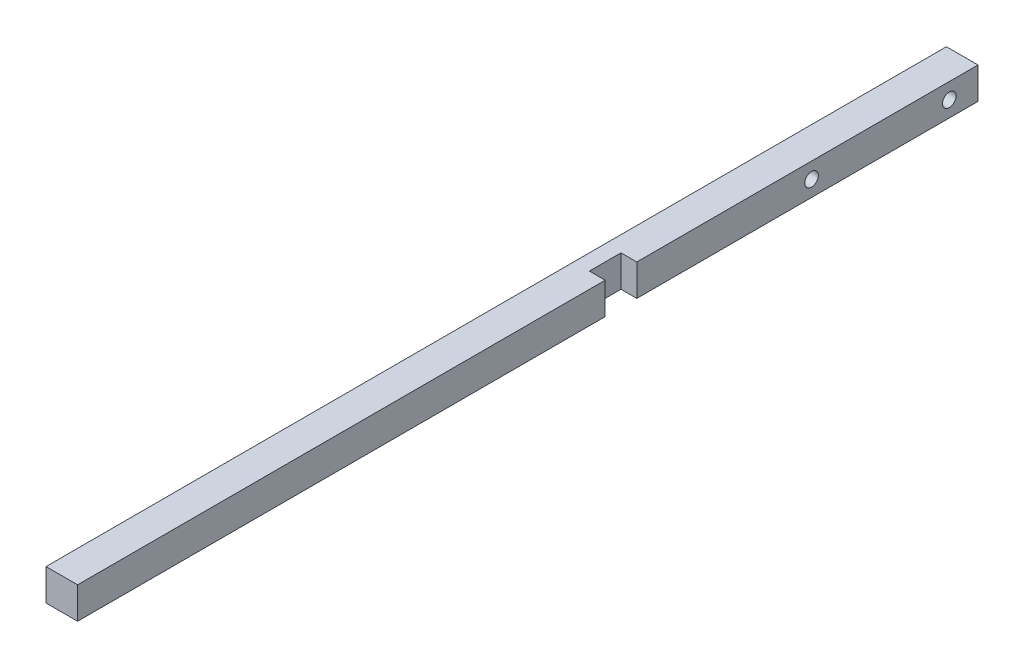
from build123d import *

# Parameters (mm, degrees)
ESQUISSE1_W                  = 10
ESQUISSE1_H                  = 10
BOSS_EXTRU_1_DEPTH           = 307
ENL_V_MAT_EXTRU_1_DEPTH      = 308.081422427
ENL_V_MAT_EXTRU_1_DEPTH_BACK = 308.081422427
ESQUISSE2_W                  = 10
ESQUISSE2_H                  = 22
D_GAGEMENT_M41_OUTLINE_W     = 10
D_GAGEMENT_M41_OUTLINE_H     = 10
D_GAGEMENT_M41_OUTLINE_R     = 2.15
D_GAGEMENT_M41_DEPTH         = 5
D_GAGEMENT_START             = -5
D_GAGEMENT_M41_2_OUTLINE_R   = 2.15
D_GAGEMENT_M41_2_DEPTH       = 5


# Read off the part's stored shape, not the designer's step: Dégagement M41
with BuildPart() as part:
    # Esquisse1 → Boss.-Extru.1 (new body)
    with BuildSketch(Plane.XY):
        Rectangle(ESQUISSE1_W, ESQUISSE1_H)
    extrude(amount=BOSS_EXTRU_1_DEPTH)

    # Esquisse2 → Enlèv. mat.-Extru.1 (cut, two sides: drawn at the far end of the back side and taken through both)
    with BuildSketch(Plane(origin=(0, 0, 0), x_dir=(1, 0, 0), z_dir=(0, 1, 0)).offset(-ENL_V_MAT_EXTRU_1_DEPTH_BACK)):
        with Locations((0, -11)):
            Rectangle(ESQUISSE2_W, ESQUISSE2_H)
    extrude(amount=ENL_V_MAT_EXTRU_1_DEPTH + ENL_V_MAT_EXTRU_1_DEPTH_BACK, mode=Mode.SUBTRACT)

    # Dégagement M41 outline → Dégagement M41 (cut)
    with BuildSketch(Plane.YZ):
        with Locations((0, 135)):
            Rectangle(D_GAGEMENT_M41_OUTLINE_W, D_GAGEMENT_M41_OUTLINE_H)
        with Locations((0, 31.09)):
            Circle(D_GAGEMENT_M41_OUTLINE_R)
        with Locations((0, 74.69)):
            Circle(D_GAGEMENT_M41_OUTLINE_R)
    extrude(amount=D_GAGEMENT_M41_DEPTH, mode=Mode.SUBTRACT)

    # D_gagement M41 2 outline → D_gagement M41 2 (cut)
    with BuildSketch(Plane.YZ.offset(D_GAGEMENT_START)):
        with Locations((0, 31.09)):
            Circle(D_GAGEMENT_M41_2_OUTLINE_R)
        with Locations((0, 74.69)):
            Circle(D_GAGEMENT_M41_2_OUTLINE_R)
    extrude(amount=D_GAGEMENT_M41_2_DEPTH, mode=Mode.SUBTRACT)


solid = part.part
